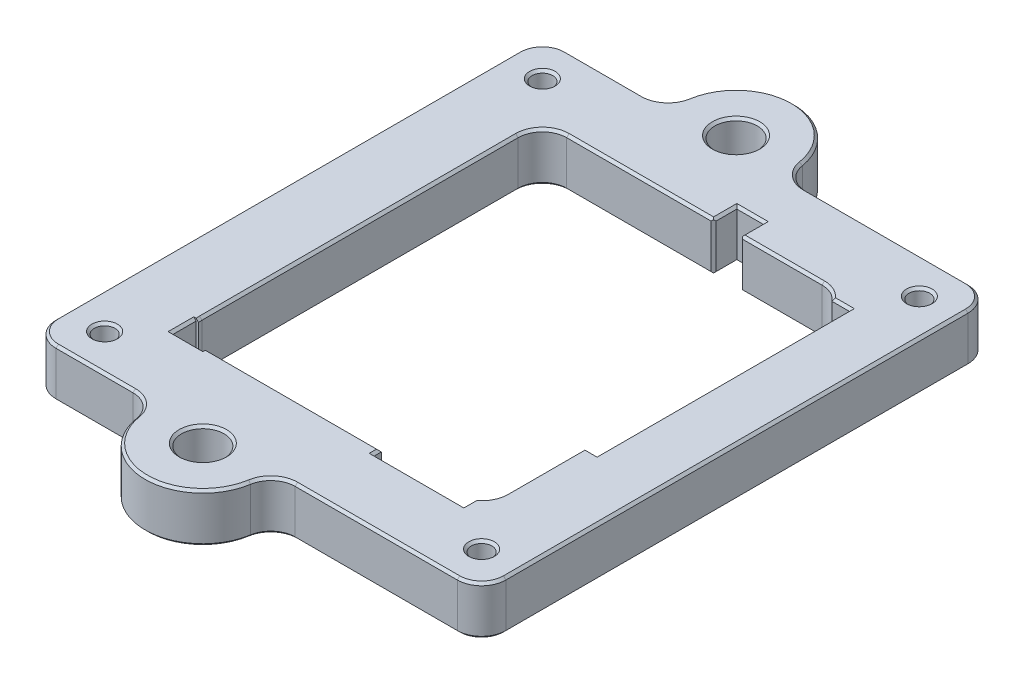
from build123d import *

# Parameters (mm, degrees)
SKETCH_1_W          = 37
SKETCH_1_H          = 42
SKETCH_1_R          = 0.85
SKETCH_1_W_2        = 25
SKETCH_1_H_2        = 30
EXTRUDE_1_DEPTH     = 4
EXTRUDE_2_DEPTH     = 4
SKETCH_3_R          = 1.75
CUT_EXTRUDE_1_DEPTH = 4
FILLET_1_R          = 2
CHAMFER_1_SIZE      = 0.2
SKETCH_4_W          = 3.34914024
SKETCH_4_H          = 20.754450631
CUT_EXTRUDE_2_DEPTH = 61.480621903
SKETCH_5_W          = 2.181314946
SKETCH_5_H          = 1.911743812
SKETCH_5_W_2        = 2.65724377
SKETCH_5_H_2        = 1.905604191
CUT_EXTRUDE_3_DEPTH = 61.480621903
SKETCH_6_W          = 7.38341045
SKETCH_6_H          = 2.27192549
CUT_EXTRUDE_4_DEPTH = 61.480621903
CHAMFER_2_SIZE      = 0.2


with BuildPart() as part:
    # 草图1 → 凸台-拉伸1 (new body)
    with BuildSketch(Plane(origin=(0, 0, 0), x_dir=(1, 0, 0), z_dir=(0, 1, 0))):
        with Locations((18.5, 21)):
            Rectangle(SKETCH_1_W, SKETCH_1_H)
        with Locations(Location((3, 3, 0), (0, 0, 270))):
            Circle(SKETCH_1_R, mode=Mode.SUBTRACT)
        with Locations(Location((34, 3, 0), (0, 0, 270))):
            Circle(SKETCH_1_R, mode=Mode.SUBTRACT)
        with Locations(Location((34, 39, 0), (0, 0, 270))):
            Circle(SKETCH_1_R, mode=Mode.SUBTRACT)
        with Locations(Location((3, 39, 0), (0, 0, 270))):
            Circle(SKETCH_1_R, mode=Mode.SUBTRACT)
        with Locations((18.5, 21)):
            Rectangle(SKETCH_1_W_2, SKETCH_1_H_2, mode=Mode.SUBTRACT)
    extrude(amount=EXTRUDE_1_DEPTH)

    # 草图2 → 凸台-拉伸2 (add)
    with BuildSketch(Plane(origin=(0, 0, 0), x_dir=(-1, 0, 0), z_dir=(0, -1, 0))):
        with BuildLine():
            ThreePointArc((-13.514444548, 0), (-13.317409432, -0.443970916), (-13.25, -0.925))
            ThreePointArc((-13.25, -0.925), (-15.481029084, -2.607590568), (-16.485555452, 0))
            Line((-16.485555452, 0), (-19.659063747, 0))
            ThreePointArc((-19.659063747, 0), (-15.464729599, -5.652211271), (-10.25, -0.925))
            ThreePointArc((-10.25, -0.925), (-10.272788729, -0.460270401), (-10.340936253, 0))
            Line((-10.340936253, 0), (-13.514444548, 0))
        make_face()
        with BuildLine():
            ThreePointArc((-16.485555452, 0), (-15, 0.825), (-13.514444548, 0))
            Line((-13.514444548, 0), (-10.340936253, 0))
            ThreePointArc((-10.340936253, 0), (-15, 3.825), (-19.659063747, 0))
            Line((-19.659063747, 0), (-16.485555452, 0))
        make_face()
        with BuildLine():
            ThreePointArc((-16.485555452, 42), (-15.481029084, 44.607590568), (-13.25, 42.925))
            ThreePointArc((-13.25, 42.925), (-13.317409432, 42.443970916), (-13.514444548, 42))
            Line((-13.514444548, 42), (-10.340936253, 42))
            ThreePointArc((-10.340936253, 42), (-10.272788729, 42.460270401), (-10.25, 42.925))
            ThreePointArc((-10.25, 42.925), (-15.464729599, 47.652211271), (-19.659063747, 42))
            Line((-19.659063747, 42), (-16.485555452, 42))
        make_face()
        with BuildLine():
            ThreePointArc((-13.514444548, 42), (-15, 41.175), (-16.485555452, 42))
            Line((-16.485555452, 42), (-19.659063747, 42))
            ThreePointArc((-19.659063747, 42), (-15, 38.175), (-10.340936253, 42))
            Line((-10.340936253, 42), (-13.514444548, 42))
        make_face()
    extrude(amount=-EXTRUDE_2_DEPTH)

    # 草图3 → 切除-拉伸1 (cut)
    with BuildSketch(Plane(origin=(0, 0, 0), x_dir=(-1, 0, 0), z_dir=(0, -1, 0))):
        with Locations(Location((-15, -0.925, 0), (0, 0, 90))):
            Circle(SKETCH_3_R)
        with Locations(Location((-15, 42.925, 0), (0, 0, 90))):
            Circle(SKETCH_3_R)
    extrude(amount=-CUT_EXTRUDE_1_DEPTH, mode=Mode.SUBTRACT)

    # 圆角1
    fillet_1_edges = [part.edges().sort_by_distance(p)[0] for p in [
        (6, 2, -6),
        (31, 2, -6),
        (31, 2, -36),
        (6, 2, -36),
        (19.659063747, 2, 0),
        (10.340936253, 2, 0),
        (10.340936253, 2, -42),
        (19.659063747, 2, -42),
        (0, 2, -42),
        (37, 2, -42),
        (37, 2, 0),
        (0, 2, 0),
    ]]
    fillet(fillet_1_edges, radius=FILLET_1_R)

    # 倒角1
    chamfer_1_edges = [part.edges().sort_by_distance(p)[0] for p in [
        (31, 0, -21),
        (31, 4, -21),
        (18.5, 0, -36),
        (18.5, 4, -36),
        (6, 0, -21),
        (6, 4, -21),
        (5.168075819, 4, -42),
        (5.168075819, 0, -42),
        (15, 0, -47.675),
        (15, 4, -47.675),
        (28.331924181, 0, -42),
        (28.331924181, 4, -42),
        (0, 0, -21),
        (37, 0, -21),
        (28.331924181, 0, 0),
        (15, 0, 5.675),
        (5.168075819, 0, 0),
        (0.585786438, 0, -0.585786438),
        (0.585786438, 0, -41.414213562),
        (36.414213562, 0, -0.585786438),
        (36.414213562, 0, -41.414213562),
        (37, 4, -21),
        (0, 4, -21),
        (5.168075819, 4, 0),
        (3, 0, -3.85),
        (15, 4, 5.675),
        (28.331924181, 4, 0),
        (0.585786438, 4, -0.585786438),
        (0.585786438, 4, -41.414213562),
        (36.414213562, 4, -0.585786438),
        (3, 4, -3.85),
        (36.414213562, 4, -41.414213562),
        (30.414213562, 0, -6.585786438),
        (30.414213562, 4, -6.585786438),
        (30.414213562, 0, -35.414213562),
        (30.414213562, 4, -35.414213562),
        (6.585786438, 0, -35.414213562),
        (6.585786438, 4, -35.414213562),
        (6.585786438, 0, -6.585786438),
        (6.585786438, 4, -6.585786438),
        (9.632871145, 0, -42.477331777),
        (9.632871145, 4, -42.477331777),
        (20.367128855, 0, -42.477331777),
        (20.367128855, 4, -42.477331777),
        (20.367128855, 0, 0.477331777),
        (20.367128855, 4, 0.477331777),
        (9.632871145, 0, 0.477331777),
        (9.632871145, 4, 0.477331777),
        (34, 0, -3.85),
        (34, 4, -3.85),
        (34, 0, -39.85),
        (34, 4, -39.85),
        (3, 0, -39.85),
        (3, 4, -39.85),
        (15.849632273, 0, -0.604910128),
        (15.849632273, 4, -0.604910128),
        (16.529910128, 0, -43.774632273),
        (16.529910128, 4, -43.774632273),
        (18.5, 0, -6),
        (18.5, 4, -6),
    ]]
    chamfer(chamfer_1_edges, length=CHAMFER_1_SIZE)

    # 草图4 → 切除-拉伸2 (cut, through all)
    with BuildSketch(Plane(origin=(0, 4, 0), x_dir=(1, 0, 0), z_dir=(0, 1, 0))):
        with Locations((30.32542988, 24.876731494)):
            Rectangle(SKETCH_4_W, SKETCH_4_H)
    extrude(amount=-CUT_EXTRUDE_2_DEPTH, mode=Mode.SUBTRACT)

    # 草图5 → 切除-拉伸3 (cut, through all)
    with BuildSketch(Plane(origin=(0, 4, 0), x_dir=(1, 0, 0), z_dir=(0, 1, 0))):
        with Locations((21.168606331, 36.955871906)):
            Rectangle(SKETCH_5_W, SKETCH_5_H)
        with Locations((7.148408339, 6.752802096)):
            Rectangle(SKETCH_5_W_2, SKETCH_5_H_2)
    extrude(amount=-CUT_EXTRUDE_3_DEPTH, mode=Mode.SUBTRACT)

    # 草图6 → 切除-拉伸4 (cut, through all)
    with BuildSketch(Plane(origin=(0, 4, 0), x_dir=(1, 0, 0), z_dir=(0, 1, 0))):
        with Locations((26.449692627, 6.535962745)):
            Rectangle(SKETCH_6_W, SKETCH_6_H)
    extrude(amount=-CUT_EXTRUDE_4_DEPTH, mode=Mode.SUBTRACT)

    # 倒角2
    # the kernel refuses this chamfer: 0.2 mm, written as the material it takes off along each edge
    with BuildSketch(Plane(origin=(5.305449856, 0, -5.8), x_dir=(0, 0, 1), z_dir=(1, 0, 0))) as chamfer_2_piece_1_section:
        Polygon((CHAMFER_2_SIZE, 0), (0, -CHAMFER_2_SIZE), (0, 0), align=None)
    chamfer_2_piece_1 = extrude(amount=3.171580368, mode=Mode.PRIVATE)
    chamfer_2_piece_1 = split(chamfer_2_piece_1, bisect_by=Plane(origin=(5.462618155, -0.157168299, -5.8), z_dir=(0.7071067811865476, -0.7071067811865476, 0)), keep=Keep.TOP, mode=Mode.PRIVATE)
    add(chamfer_2_piece_1, mode=Mode.SUBTRACT)
    with BuildSketch(Plane(origin=(32, 0, -35.768293407), x_dir=(1, 0, 0), z_dir=(0, 0, 1))) as chamfer_2_piece_2_section:
        Polygon((CHAMFER_2_SIZE, 0), (0, CHAMFER_2_SIZE), (0, 0), align=None)
    chamfer_2_piece_2 = extrude(amount=21.783123826, mode=Mode.PRIVATE)
    chamfer_2_piece_2 = split(chamfer_2_piece_2, bisect_by=Plane(origin=(32, -0.157168299, -35.611125108), z_dir=(0, -0.7071067811865522, 0.7071067811865429)), keep=Keep.TOP, mode=Mode.PRIVATE)
    chamfer_2_piece_2 = split(chamfer_2_piece_2, bisect_by=Plane(origin=(32, 10.734393614, -25.033899792), z_dir=(0, -0.707106781186546, -0.7071067811865491)), keep=Keep.TOP, mode=Mode.PRIVATE)
    add(chamfer_2_piece_2, mode=Mode.SUBTRACT)
    with BuildSketch(Plane(origin=(32.514336598, 0, -14.499506178), x_dir=(0, 0, 1), z_dir=(-1, 0, 0))) as chamfer_2_piece_3_section:
        Polygon((CHAMFER_2_SIZE, 0), (0, CHAMFER_2_SIZE), (0, 0), align=None)
    chamfer_2_piece_3 = extrude(amount=1.828673195, mode=Mode.PRIVATE)
    chamfer_2_piece_3 = split(chamfer_2_piece_3, bisect_by=Plane(origin=(32.357168299, -0.157168299, -14.499506178), z_dir=(-0.7071067811865429, -0.7071067811865522, 0)), keep=Keep.TOP, mode=Mode.PRIVATE)
    add(chamfer_2_piece_3, mode=Mode.SUBTRACT)
    with BuildSketch(Plane(origin=(30.293311687, 0, -35.253956809), x_dir=(0, 0, -1), z_dir=(1, 0, 0))) as chamfer_2_piece_4_section:
        Polygon((CHAMFER_2_SIZE, 0), (0, CHAMFER_2_SIZE), (0, 0), align=None)
    chamfer_2_piece_4 = extrude(amount=2.221024911, mode=Mode.PRIVATE)
    chamfer_2_piece_4 = split(chamfer_2_piece_4, bisect_by=Plane(origin=(31.246655844, 0.953344156, -35.253956809), z_dir=(-0.7071067811865429, -0.7071067811865522, 0)), keep=Keep.TOP, mode=Mode.PRIVATE)
    add(chamfer_2_piece_4, mode=Mode.SUBTRACT)
    with BuildSketch(Plane(origin=(32.514336598, 4, -14.499506178), x_dir=(0, 0, 1), z_dir=(-1, 0, 0))) as chamfer_2_piece_5_section:
        Polygon((CHAMFER_2_SIZE, 0), (0, -CHAMFER_2_SIZE), (0, 0), align=None)
    chamfer_2_piece_5 = extrude(amount=1.828673195, mode=Mode.PRIVATE)
    chamfer_2_piece_5 = split(chamfer_2_piece_5, bisect_by=Plane(origin=(32.357168299, 4.157168299, -14.499506178), z_dir=(-0.7071067811865429, 0.7071067811865522, 0)), keep=Keep.TOP, mode=Mode.PRIVATE)
    add(chamfer_2_piece_5, mode=Mode.SUBTRACT)
    with BuildSketch(Plane(origin=(32, 4, -35.768293407), x_dir=(1, 0, 0), z_dir=(0, 0, 1))) as chamfer_2_piece_6_section:
        Polygon((CHAMFER_2_SIZE, 0), (0, -CHAMFER_2_SIZE), (0, 0), align=None)
    chamfer_2_piece_6 = extrude(amount=21.783123826, mode=Mode.PRIVATE)
    chamfer_2_piece_6 = split(chamfer_2_piece_6, bisect_by=Plane(origin=(32, 4.157168299, -35.611125108), z_dir=(0, 0.7071067811865522, 0.7071067811865429)), keep=Keep.TOP, mode=Mode.PRIVATE)
    chamfer_2_piece_6 = split(chamfer_2_piece_6, bisect_by=Plane(origin=(32, -6.734393614, -25.033899792), z_dir=(0, 0.707106781186546, -0.7071067811865491)), keep=Keep.TOP, mode=Mode.PRIVATE)
    add(chamfer_2_piece_6, mode=Mode.SUBTRACT)
    with BuildSketch(Plane(origin=(30.293311687, 4, -35.253956809), x_dir=(0, 0, -1), z_dir=(1, 0, 0))) as chamfer_2_piece_7_section:
        Polygon((CHAMFER_2_SIZE, 0), (0, -CHAMFER_2_SIZE), (0, 0), align=None)
    chamfer_2_piece_7 = extrude(amount=2.221024911, mode=Mode.PRIVATE)
    chamfer_2_piece_7 = split(chamfer_2_piece_7, bisect_by=Plane(origin=(31.246655844, 3.046655844, -35.253956809), z_dir=(-0.7071067811865429, 0.7071067811865522, 0)), keep=Keep.TOP, mode=Mode.PRIVATE)
    add(chamfer_2_piece_7, mode=Mode.SUBTRACT)
    with BuildSketch(Plane(origin=(22.259263804, 0, -38.42608041), x_dir=(1, 0, 0), z_dir=(0, 0, 1))) as chamfer_2_piece_8_section:
        Polygon((CHAMFER_2_SIZE, 0), (0, CHAMFER_2_SIZE), (0, 0), align=None)
    chamfer_2_piece_8 = extrude(amount=2.740417007, mode=Mode.PRIVATE)
    chamfer_2_piece_8 = split(chamfer_2_piece_8, bisect_by=Plane(origin=(22.259263804, -0.157168299, -38.268912111), z_dir=(0, -0.7071067811865522, 0.7071067811865429)), keep=Keep.TOP, mode=Mode.PRIVATE)
    add(chamfer_2_piece_8, mode=Mode.SUBTRACT)
    with BuildSketch(Plane(origin=(22.259263804, 4.314336598, -36), x_dir=(0, 0, -1), z_dir=(0, -1, 0))) as chamfer_2_piece_9:
        Polygon((CHAMFER_2_SIZE, 0), (0, CHAMFER_2_SIZE), (0, 0), align=None)
    extrude(amount=4.628673195, mode=Mode.SUBTRACT)
    with BuildSketch(Plane(origin=(20.077948858, 0, -35.685663402), x_dir=(-1, 0, 0), z_dir=(0, 0, -1))) as chamfer_2_piece_10_section:
        Polygon((CHAMFER_2_SIZE, 0), (0, CHAMFER_2_SIZE), (0, 0), align=None)
    chamfer_2_piece_10 = extrude(amount=2.740417007, mode=Mode.PRIVATE)
    chamfer_2_piece_10 = split(chamfer_2_piece_10, bisect_by=Plane(origin=(20.077948858, 1.213040205, -36.898703607), z_dir=(0, -0.7071067811865522, 0.7071067811865429)), keep=Keep.TOP, mode=Mode.PRIVATE)
    add(chamfer_2_piece_10, mode=Mode.SUBTRACT)
    with BuildSketch(Plane(origin=(20.077948858, 4.314336598, -36), x_dir=(0, 0, -1), z_dir=(0, -1, 0))) as chamfer_2_piece_11:
        Polygon((CHAMFER_2_SIZE, 0), (0, -CHAMFER_2_SIZE), (0, 0), align=None)
    extrude(amount=4.628673195, mode=Mode.SUBTRACT)
    with BuildSketch(Plane(origin=(19.56361226, 0, -37.911743812), x_dir=(0, 0, -1), z_dir=(1, 0, 0))) as chamfer_2_piece_12_section:
        Polygon((CHAMFER_2_SIZE, 0), (0, CHAMFER_2_SIZE), (0, 0), align=None)
    chamfer_2_piece_12 = extrude(amount=3.209988141, mode=Mode.PRIVATE)
    chamfer_2_piece_12 = split(chamfer_2_piece_12, bisect_by=Plane(origin=(19.720780559, -0.157168299, -37.911743812), z_dir=(0.7071067811865491, -0.707106781186546, 0)), keep=Keep.TOP, mode=Mode.PRIVATE)
    chamfer_2_piece_12 = split(chamfer_2_piece_12, bisect_by=Plane(origin=(21.011438032, 1.447825772, -37.911743812), z_dir=(-0.7071067811865491, -0.707106781186546, 0)), keep=Keep.TOP, mode=Mode.PRIVATE)
    add(chamfer_2_piece_12, mode=Mode.SUBTRACT)
    with BuildSketch(Plane(origin=(22.259263804, 4, -38.42608041), x_dir=(1, 0, 0), z_dir=(0, 0, 1))) as chamfer_2_piece_13_section:
        Polygon((CHAMFER_2_SIZE, 0), (0, -CHAMFER_2_SIZE), (0, 0), align=None)
    chamfer_2_piece_13 = extrude(amount=2.740417007, mode=Mode.PRIVATE)
    chamfer_2_piece_13 = split(chamfer_2_piece_13, bisect_by=Plane(origin=(22.259263804, 4.157168299, -38.268912111), z_dir=(0, 0.7071067811865522, 0.7071067811865429)), keep=Keep.TOP, mode=Mode.PRIVATE)
    add(chamfer_2_piece_13, mode=Mode.SUBTRACT)
    with BuildSketch(Plane(origin=(19.56361226, 4, -37.911743812), x_dir=(0, 0, -1), z_dir=(1, 0, 0))) as chamfer_2_piece_14_section:
        Polygon((CHAMFER_2_SIZE, 0), (0, -CHAMFER_2_SIZE), (0, 0), align=None)
    chamfer_2_piece_14 = extrude(amount=3.209988141, mode=Mode.PRIVATE)
    chamfer_2_piece_14 = split(chamfer_2_piece_14, bisect_by=Plane(origin=(21.011438032, 2.552174228, -37.911743812), z_dir=(-0.7071067811865491, 0.707106781186546, 0)), keep=Keep.TOP, mode=Mode.PRIVATE)
    chamfer_2_piece_14 = split(chamfer_2_piece_14, bisect_by=Plane(origin=(19.720780559, 4.157168299, -37.911743812), z_dir=(0.7071067811865491, 0.707106781186546, 0)), keep=Keep.TOP, mode=Mode.PRIVATE)
    add(chamfer_2_piece_14, mode=Mode.SUBTRACT)
    with BuildSketch(Plane(origin=(20.077948858, 4, -35.685663402), x_dir=(-1, 0, 0), z_dir=(0, 0, -1))) as chamfer_2_piece_15_section:
        Polygon((CHAMFER_2_SIZE, 0), (0, -CHAMFER_2_SIZE), (0, 0), align=None)
    chamfer_2_piece_15 = extrude(amount=2.740417007, mode=Mode.PRIVATE)
    chamfer_2_piece_15 = split(chamfer_2_piece_15, bisect_by=Plane(origin=(20.077948858, 2.786959795, -36.898703607), z_dir=(0, 0.7071067811865522, 0.7071067811865429)), keep=Keep.TOP, mode=Mode.PRIVATE)
    add(chamfer_2_piece_15, mode=Mode.SUBTRACT)
    with BuildSketch(Plane(origin=(8.477030224, 4, -5.8), x_dir=(0, 0, 1), z_dir=(-1, 0, 0))) as chamfer_2_piece_16_section:
        Polygon((CHAMFER_2_SIZE, 0), (0, -CHAMFER_2_SIZE), (0, 0), align=None)
    chamfer_2_piece_16 = extrude(amount=3.171580368, mode=Mode.PRIVATE)
    chamfer_2_piece_16 = split(chamfer_2_piece_16, bisect_by=Plane(origin=(7.048408339, 2.571378115, -5.8), z_dir=(0.7071067811865476, 0.7071067811865476, 0)), keep=Keep.TOP, mode=Mode.PRIVATE)
    add(chamfer_2_piece_16, mode=Mode.SUBTRACT)
    with BuildSketch(Plane(origin=(5.819786454, 0, -5.285663402), x_dir=(-1, 0, 0), z_dir=(0, 0, -1))) as chamfer_2_piece_17_section:
        Polygon((CHAMFER_2_SIZE, 0), (0, CHAMFER_2_SIZE), (0, 0), align=None)
    chamfer_2_piece_17 = extrude(amount=2.419940789, mode=Mode.PRIVATE)
    chamfer_2_piece_17 = split(chamfer_2_piece_17, bisect_by=Plane(origin=(5.819786454, -0.157168299, -5.442831701), z_dir=(-2.59983931298834e-15, -0.7071067811865412, -0.7071067811865539)), keep=Keep.TOP, mode=Mode.PRIVATE)
    add(chamfer_2_piece_17, mode=Mode.SUBTRACT)
    with BuildSketch(Plane(origin=(5.819786454, 4, -5.285663402), x_dir=(-1, 0, 0), z_dir=(0, 0, -1))) as chamfer_2_piece_18_section:
        Polygon((CHAMFER_2_SIZE, 0), (0, -CHAMFER_2_SIZE), (0, 0), align=None)
    chamfer_2_piece_18 = extrude(amount=2.419940789, mode=Mode.PRIVATE)
    chamfer_2_piece_18 = split(chamfer_2_piece_18, bisect_by=Plane(origin=(5.819786454, 4.157168299, -5.442831701), z_dir=(0, 0.7071067811865476, -0.7071067811865476)), keep=Keep.TOP, mode=Mode.PRIVATE)
    add(chamfer_2_piece_18, mode=Mode.SUBTRACT)
    with BuildSketch(Plane(origin=(30.141397852, 0, -4.885663402), x_dir=(1, 0, 0), z_dir=(0, 0, -1))) as chamfer_2_piece_19_section:
        Polygon((CHAMFER_2_SIZE, 0), (0, -CHAMFER_2_SIZE), (0, 0), align=None)
    chamfer_2_piece_19 = extrude(amount=1.747925752, mode=Mode.PRIVATE)
    chamfer_2_piece_19 = split(chamfer_2_piece_19, bisect_by=Plane(origin=(30.141397852, -0.157168299, -5.042831701), z_dir=(0, -0.7071067811865476, -0.7071067811865476)), keep=Keep.TOP, mode=Mode.PRIVATE)
    add(chamfer_2_piece_19, mode=Mode.SUBTRACT)
    with BuildSketch(Plane(origin=(22.243650804, 0, -5.4), x_dir=(0, 0, 1), z_dir=(1, 0, 0))) as chamfer_2_piece_20_section:
        Polygon((CHAMFER_2_SIZE, 0), (0, -CHAMFER_2_SIZE), (0, 0), align=None)
    chamfer_2_piece_20 = extrude(amount=8.412083646, mode=Mode.PRIVATE)
    chamfer_2_piece_20 = split(chamfer_2_piece_20, bisect_by=Plane(origin=(22.400819103, -0.157168299, -5.4), z_dir=(0.7071067811865491, -0.707106781186546, 0)), keep=Keep.TOP, mode=Mode.PRIVATE)
    chamfer_2_piece_20 = split(chamfer_2_piece_20, bisect_by=Plane(origin=(26.292524328, 4.048873524, -5.4), z_dir=(-0.7071067811865491, -0.707106781186546, 0)), keep=Keep.TOP, mode=Mode.PRIVATE)
    add(chamfer_2_piece_20, mode=Mode.SUBTRACT)
    with BuildSketch(Plane(origin=(22.757987402, 0, -6.314336598), x_dir=(-1, 0, 0), z_dir=(0, 0, 1))) as chamfer_2_piece_21_section:
        Polygon((CHAMFER_2_SIZE, 0), (0, -CHAMFER_2_SIZE), (0, 0), align=None)
    chamfer_2_piece_21 = extrude(amount=1.428673195, mode=Mode.PRIVATE)
    chamfer_2_piece_21 = split(chamfer_2_piece_21, bisect_by=Plane(origin=(22.757987402, 0.557168299, -5.757168299), z_dir=(0, -0.7071067811865476, -0.7071067811865476)), keep=Keep.TOP, mode=Mode.PRIVATE)
    add(chamfer_2_piece_21, mode=Mode.SUBTRACT)
    with BuildSketch(Plane(origin=(22.757987402, 4, -6.314336598), x_dir=(-1, 0, 0), z_dir=(0, 0, 1))) as chamfer_2_piece_22_section:
        Polygon((CHAMFER_2_SIZE, 0), (0, CHAMFER_2_SIZE), (0, 0), align=None)
    chamfer_2_piece_22 = extrude(amount=1.428673195, mode=Mode.PRIVATE)
    chamfer_2_piece_22 = split(chamfer_2_piece_22, bisect_by=Plane(origin=(22.757987402, 3.442831701, -5.757168299), z_dir=(0, 0.7071067811865476, -0.7071067811865476)), keep=Keep.TOP, mode=Mode.PRIVATE)
    add(chamfer_2_piece_22, mode=Mode.SUBTRACT)
    with BuildSketch(Plane(origin=(22.243650804, 4, -5.4), x_dir=(0, 0, 1), z_dir=(1, 0, 0))) as chamfer_2_piece_23_section:
        Polygon((CHAMFER_2_SIZE, 0), (0, CHAMFER_2_SIZE), (0, 0), align=None)
    chamfer_2_piece_23 = extrude(amount=8.412083646, mode=Mode.PRIVATE)
    chamfer_2_piece_23 = split(chamfer_2_piece_23, bisect_by=Plane(origin=(22.400819103, 4.157168299, -5.4), z_dir=(0.7071067811865491, 0.707106781186546, 0)), keep=Keep.TOP, mode=Mode.PRIVATE)
    chamfer_2_piece_23 = split(chamfer_2_piece_23, bisect_by=Plane(origin=(26.292524328, -0.048873524, -5.4), z_dir=(-0.7071067811865491, 0.707106781186546, 0)), keep=Keep.TOP, mode=Mode.PRIVATE)
    add(chamfer_2_piece_23, mode=Mode.SUBTRACT)
    with BuildSketch(Plane(origin=(30.141397852, 4, -4.885663402), x_dir=(1, 0, 0), z_dir=(0, 0, -1))) as chamfer_2_piece_24_section:
        Polygon((CHAMFER_2_SIZE, 0), (0, CHAMFER_2_SIZE), (0, 0), align=None)
    chamfer_2_piece_24 = extrude(amount=1.747925752, mode=Mode.PRIVATE)
    chamfer_2_piece_24 = split(chamfer_2_piece_24, bisect_by=Plane(origin=(30.141397852, 4.157168299, -5.042831701), z_dir=(0, 0.7071067811865476, -0.7071067811865476)), keep=Keep.TOP, mode=Mode.PRIVATE)
    add(chamfer_2_piece_24, mode=Mode.SUBTRACT)


solid = part.part
